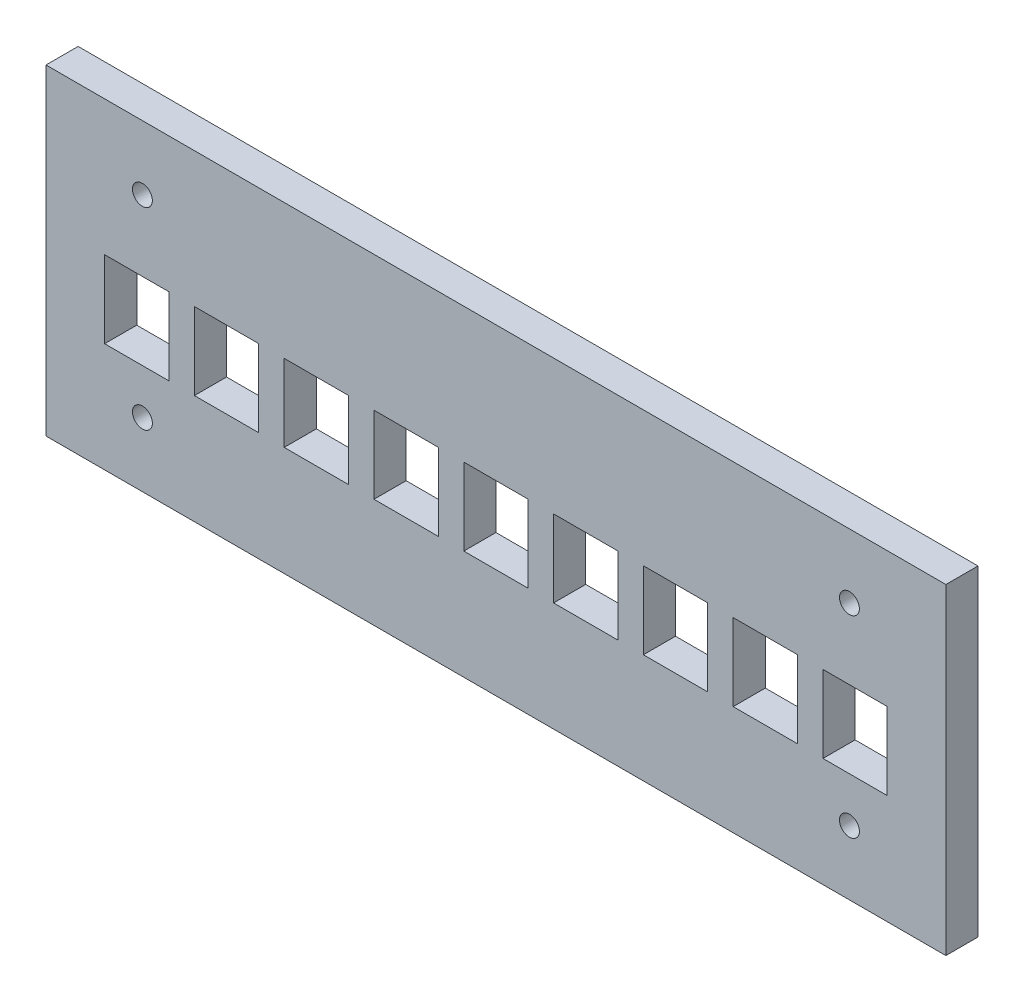
from build123d import *

# Parameters (mm, degrees)
ESQUISSE1_W        = 140
ESQUISSE1_H        = 50
ESQUISSE1_R        = 1.55
ESQUISSE1_W_2      = 10
ESQUISSE1_H_2      = 12
BOSS_EXTRU_1_DEPTH = 5


with BuildPart() as part:
    # Esquisse1 → Boss.-Extru.1 (new body)
    with BuildSketch(Plane.XY):
        Rectangle(ESQUISSE1_W, ESQUISSE1_H)
        with Locations((-55, -15)):
            Circle(ESQUISSE1_R, mode=Mode.SUBTRACT)
        with Locations((-55, 15)):
            Circle(ESQUISSE1_R, mode=Mode.SUBTRACT)
        with Locations((55, -15)):
            Circle(ESQUISSE1_R, mode=Mode.SUBTRACT)
        with Locations((55, 15)):
            Circle(ESQUISSE1_R, mode=Mode.SUBTRACT)
        with Locations((13.97, -2)):
            Rectangle(ESQUISSE1_W_2, ESQUISSE1_H_2, mode=Mode.SUBTRACT)
        with Locations((0, -2)):
            Rectangle(ESQUISSE1_W_2, ESQUISSE1_H_2, mode=Mode.SUBTRACT)
        with Locations((27.94, -2)):
            Rectangle(ESQUISSE1_W_2, ESQUISSE1_H_2, mode=Mode.SUBTRACT)
        with Locations((41.91, -2)):
            Rectangle(ESQUISSE1_W_2, ESQUISSE1_H_2, mode=Mode.SUBTRACT)
        with Locations((55.88, -2)):
            Rectangle(ESQUISSE1_W_2, ESQUISSE1_H_2, mode=Mode.SUBTRACT)
        with Locations((-13.97, -2)):
            Rectangle(ESQUISSE1_W_2, ESQUISSE1_H_2, mode=Mode.SUBTRACT)
        with Locations((-27.94, -2)):
            Rectangle(ESQUISSE1_W_2, ESQUISSE1_H_2, mode=Mode.SUBTRACT)
        with Locations((-41.91, -2)):
            Rectangle(ESQUISSE1_W_2, ESQUISSE1_H_2, mode=Mode.SUBTRACT)
        with Locations((-55.88, -2)):
            Rectangle(ESQUISSE1_W_2, ESQUISSE1_H_2, mode=Mode.SUBTRACT)
    extrude(amount=-BOSS_EXTRU_1_DEPTH)


solid = part.part
